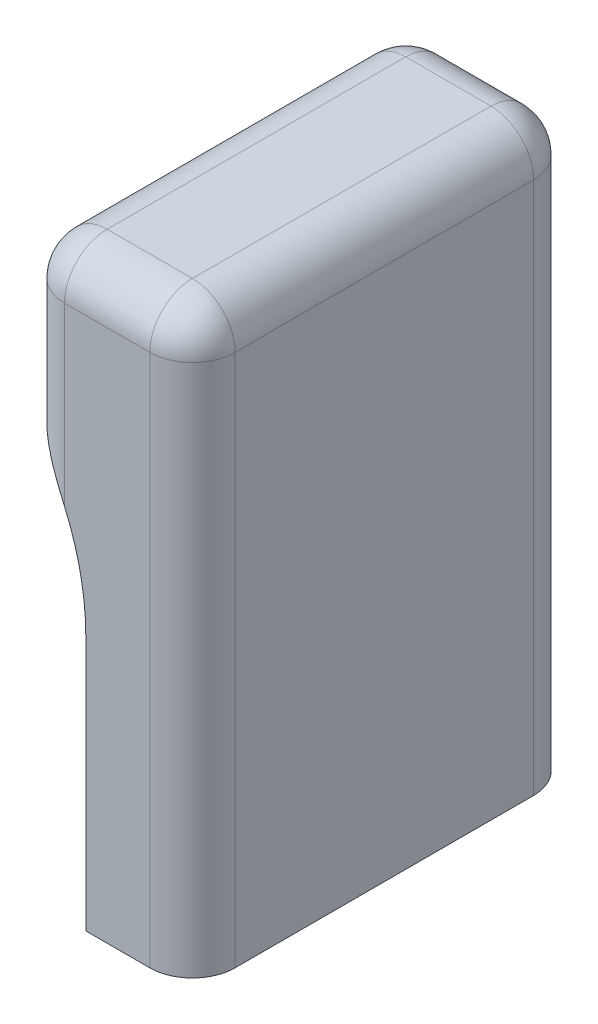
from build123d import *

# Parameters (mm, degrees)
SKETCH1_W           = 8
SKETCH1_H           = 18
BOSS_EXTRUDE1_DEPTH = 27
SKETCH2_R           = 11.96
CUT_EXTRUDE1_DEPTH  = 30
SKETCH3_W           = 3.757980454
SKETCH3_H           = 11.96
CUT_EXTRUDE2_DEPTH  = 30
FILLET1_R           = 2
FILLET2_R           = 2
FILLET3_R           = 2


with BuildPart() as part:
    # Sketch1 → Boss-Extrude1 (new body)
    with BuildSketch(Plane(origin=(0, 0, 0), x_dir=(1, 0, 0), z_dir=(0, 1, 0))):
        Rectangle(SKETCH1_W, SKETCH1_H)
    extrude(amount=BOSS_EXTRUDE1_DEPTH)

    # Sketch2 → Cut-Extrude1 (cut)
    with BuildSketch(Plane.XY.offset(9)):
        with Locations((-12.96, 11.96)):
            Circle(SKETCH2_R)
    extrude(amount=-CUT_EXTRUDE1_DEPTH, mode=Mode.SUBTRACT)

    # Sketch3 → Cut-Extrude2 (cut)
    with BuildSketch(Plane.XY.offset(9)):
        with Locations((-2.878990227, 5.98)):
            Rectangle(SKETCH3_W, SKETCH3_H)
    extrude(amount=-CUT_EXTRUDE2_DEPTH, mode=Mode.SUBTRACT)

    # Fillet1
    fillet1_edges = [part.edges().sort_by_distance(p)[0] for p in [
        (4, 13.5, 9),
    ]]
    fillet(fillet1_edges, radius=FILLET1_R)

    # Fillet2
    fillet2_edges = [part.edges().sort_by_distance(p)[0] for p in [
        (-4, 27, 0),
        (-1, 27, 9),
        (4, 27, -1),
        (3.414213562, 27, 8.414213562),
        (4, 13.5, -9),
        (0, 27, -9),
    ]]
    fillet(fillet2_edges, radius=FILLET2_R)

    # Fillet3
    # the kernel refuses this fillet: 2 mm, written as the material it takes off along each edge
    with BuildSketch(Plane(origin=(-2, 25, -7), x_dir=(0, 0, -1), z_dir=(-1, 0, 0))) as fillet3_piece_1_section:
        Polygon((0, 0), (FILLET3_R, 0), (FILLET3_R, -FILLET3_R), (0, -FILLET3_R), align=None)
    fillet3_piece_1 = extrude(amount=FILLET3_R, mode=Mode.PRIVATE)
    fillet3_piece_1 = fillet3_piece_1 - Plane(origin=(-2, 25, -7), x_dir=(0, -0.7071067811865475, 0.7071067811865475), z_dir=(-1, 0, 0)) * Sphere(FILLET3_R, mode=Mode.PRIVATE)
    add(fillet3_piece_1, mode=Mode.SUBTRACT)
    with BuildSketch(Plane(origin=(-2, 25, 7), x_dir=(-1, 0, 0), z_dir=(0, 0, 1))) as fillet3_piece_2_section:
        Polygon((0, 0), (FILLET3_R, 0), (FILLET3_R, -FILLET3_R), (0, -FILLET3_R), align=None)
    fillet3_piece_2 = extrude(amount=FILLET3_R, mode=Mode.PRIVATE)
    fillet3_piece_2 = fillet3_piece_2 - Plane(origin=(-2, 25, 7), x_dir=(0.7071067811865475, -0.7071067811865475, 0), z_dir=(0, 0, 1)) * Sphere(FILLET3_R, mode=Mode.PRIVATE)
    add(fillet3_piece_2, mode=Mode.SUBTRACT)
    with BuildSketch(Plane(origin=(-4, 19.882120928, -10.810664001), x_dir=(0, 1, 0), z_dir=(0, 0, 1))) as fillet3_piece_3:
        with BuildLine():
            CenterArc((0.7242656, -2), FILLET3_R, 90, 38.270045509)
            ThreePointArc((-0.514471725, -0.429799427), (-0.254223892, -0.218505055), (0, 0))
            Line((0, 0), (0.7242656, 0))
        make_face()
    extrude(amount=21.621328002, mode=Mode.SUBTRACT)
    with BuildSketch(Plane(origin=(-4, 14.882120928, 9), x_dir=(1, 0, 0), z_dir=(0, 1, 0)), Plane(origin=(-4, 14.882120928, -9), x_dir=(0, 0, 1), z_dir=(0, 1, 0))) as fillet3_piece_4:
        with BuildLine():
            CenterArc((FILLET3_R, FILLET3_R), FILLET3_R, 180, 90)
            Line((0, FILLET3_R), (0, 0))
            Line((0, 0), (FILLET3_R, 0))
        make_face()
    extrude(amount=10.117879072, mode=Mode.SUBTRACT)


solid = part.part
